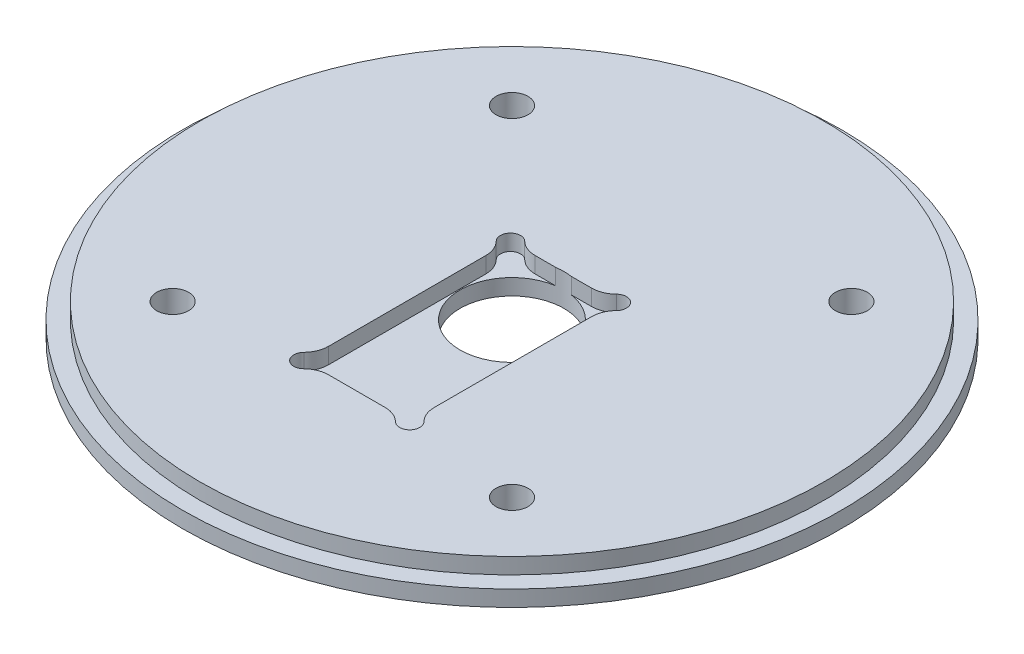
from build123d import *

# Parameters (mm, degrees)
SKETCH2_R                       = 65.405
BOSS_EXTRUDE1_DEPTH             = 6.35
CUT_EXTRUDE1_START              = -3.175
SKETCH4_R                       = 65.405
SKETCH4_R_2                     = 61.976
CUT_EXTRUDE1_DEPTH              = 3.175
F_1_4_0_25_DIAMETER_HOLE1_D     = 6.35
F_13_16_0_8125_DIAMETER_HOLE1_D = 20.6375
CUT_EXTRUDE3_DEPTH              = 3.175
SKETCH9_R                       = 6.0325
CUT_EXTRUDE2_DEPTH              = 1.5875


with BuildPart() as part:
    # Sketch2 → Boss-Extrude1 (new body)
    with BuildSketch(Plane(origin=(0, 0, 0), x_dir=(1, 0, 0), z_dir=(0, 1, 0))):
        Circle(SKETCH2_R)
    extrude(amount=BOSS_EXTRUDE1_DEPTH)

    # Sketch4 → Cut-Extrude1 (cut)
    with BuildSketch(Plane(origin=(0, 6.35, 0), x_dir=(1, 0, 0), z_dir=(0, 1, 0)).offset(CUT_EXTRUDE1_START)):
        Circle(SKETCH4_R)
        Circle(SKETCH4_R_2, mode=Mode.SUBTRACT)
    extrude(amount=CUT_EXTRUDE1_DEPTH, mode=Mode.SUBTRACT)

    # 1/4 (0.25) Diameter Hole1 (through all)
    with Locations(Plane(origin=(0, 6.35, 0), x_dir=(1, 0, 0), z_dir=(0, 1, 0))):
        with Locations((-33.675960454, 33.675960454), (-33.675960454, -33.675960454), (33.675960454, 33.675960454), (33.675960454, -33.675960454)):
            Hole(F_1_4_0_25_DIAMETER_HOLE1_D / 2)

    # 13/16 (0.8125) Diameter Hole1 (through all)
    with Locations(Plane(origin=(0, 6.35, 0), x_dir=(1, 0, 0), z_dir=(0, 1, 0))):
        with Locations((0, 0)):
            Hole(F_13_16_0_8125_DIAMETER_HOLE1_D / 2)

    # Sketch11 → Cut-Extrude3 (cut)
    with BuildSketch(Plane(origin=(0, 6.35, 0), x_dir=(1, 0, 0), z_dir=(0, 1, 0))):
        with BuildLine():
            Line((-5.601020514, 10.2), (5.601020514, 10.2))
            ThreePointArc((5.601020514, 10.2), (7.490842879, 10.570899501), (9.100291576, 11.628571429))
            ThreePointArc((9.100291576, 11.628571429), (11.914213562, 11.614213562), (11.928571429, 8.800291576))
            ThreePointArc((11.928571429, 8.800291576), (10.870899501, 7.190842879), (10.5, 5.301020514))
            Line((10.5, 5.301020514), (10.5, -25.901020514))
            ThreePointArc((10.5, -25.901020514), (10.870899501, -27.790842879), (11.928571429, -29.400291576))
            ThreePointArc((11.928571429, -29.400291576), (11.914213562, -32.214213562), (9.100291576, -32.228571429))
            ThreePointArc((9.100291576, -32.228571429), (7.490842879, -31.170899501), (5.601020514, -30.8))
            Line((5.601020514, -30.8), (-5.601020514, -30.8))
            ThreePointArc((-5.601020514, -30.8), (-7.490842879, -31.170899501), (-9.100291576, -32.228571429))
            ThreePointArc((-9.100291576, -32.228571429), (-11.914213562, -32.214213562), (-11.928571429, -29.400291576))
            ThreePointArc((-11.928571429, -29.400291576), (-10.870899501, -27.790842879), (-10.5, -25.901020514))
            Line((-10.5, -25.901020514), (-10.5, 5.301020514))
            ThreePointArc((-10.5, 5.301020514), (-10.870899501, 7.190842879), (-11.928571429, 8.800291576))
            ThreePointArc((-11.928571429, 8.800291576), (-11.914213562, 11.614213562), (-9.100291576, 11.628571429))
            ThreePointArc((-9.100291576, 11.628571429), (-7.490842879, 10.570899501), (-5.601020514, 10.2))
        make_face()
    extrude(amount=-CUT_EXTRUDE3_DEPTH, mode=Mode.SUBTRACT)

    # Sketch9 → Cut-Extrude2 (cut)
    with BuildSketch(Plane.XZ):
        with Locations((-33.675960454, 33.675960454)):
            Circle(SKETCH9_R)
        with Locations((33.675960454, 33.675960454)):
            Circle(SKETCH9_R)
        with Locations((33.675960454, -33.675960454)):
            Circle(SKETCH9_R)
        with Locations((-33.675960454, -33.675960454)):
            Circle(SKETCH9_R)
    extrude(amount=-CUT_EXTRUDE2_DEPTH, mode=Mode.SUBTRACT)


solid = part.part
